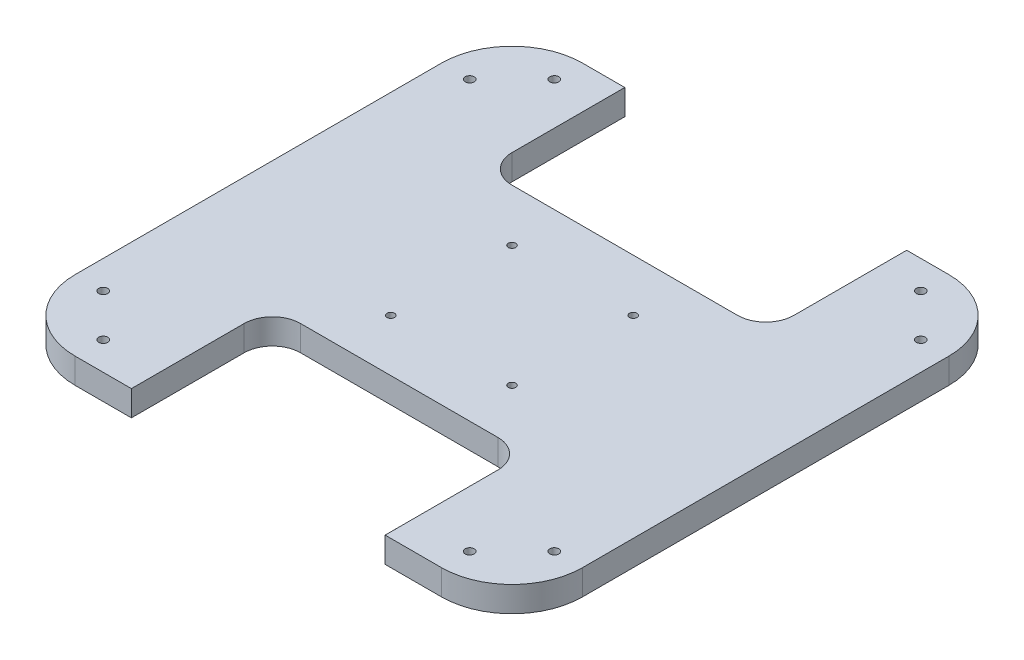
from build123d import *

# Parameters (mm, degrees)
PLATE_DEPTH        = 9
SKETCH3_R          = 1.6
HEX_HOLES_DEPTH    = 128.597021909
SKETCH4_R          = 1.325
LIDAR_HOLES_DEPTH  = 128.597021909
SKETCH5_W          = 100
SKETCH5_H          = 50
SKETCH5_W_2        = 90
CUT_EXTRUDE1_DEPTH = 128.597021909
SKETCH6_R          = 3.5
CUT_EXTRUDE2_DEPTH = 5
FILLET1_R          = 10


with BuildPart() as part:
    # Sketch1 → Plate (new body)
    with BuildSketch(Plane(origin=(0, 0, 0), x_dir=(1, 0, 0), z_dir=(0, 1, 0))):
        with BuildLine():
            Line((-65, -90), (65, -90))
            ThreePointArc((65, -90), (82.67766953, -82.67766953), (90, -65))
            Line((90, -65), (90, 65))
            ThreePointArc((90, 65), (82.67766953, 82.67766953), (65, 90))
            Line((65, 90), (-65, 90))
            ThreePointArc((-65, 90), (-82.67766953, 82.67766953), (-90, 65))
            Line((-90, 65), (-90, -65))
            ThreePointArc((-90, -65), (-82.67766953, -82.67766953), (-65, -90))
        make_face()
    extrude(amount=PLATE_DEPTH)

    # Sketch3 → Hex Holes (cut, through all)
    with BuildSketch(Plane(origin=(0, 9, 0), x_dir=(1, 0, 0), z_dir=(0, 1, 0))):
        with Locations((-65, 80)):
            Circle(SKETCH3_R)
        with Locations((-80, 65)):
            Circle(SKETCH3_R)
        with Locations((80, 65)):
            Circle(SKETCH3_R)
        with Locations((80, -65)):
            Circle(SKETCH3_R)
        with Locations((65, 80)):
            Circle(SKETCH3_R)
        with Locations((65, -80)):
            Circle(SKETCH3_R)
        with Locations((-65, -80)):
            Circle(SKETCH3_R)
        with Locations((-80, -65)):
            Circle(SKETCH3_R)
    extrude(amount=-HEX_HOLES_DEPTH, mode=Mode.SUBTRACT)

    # Sketch4 → LiDAR Holes (cut, through all)
    with BuildSketch(Plane(origin=(0, 9, 0), x_dir=(1, 0, 0), z_dir=(0, 1, 0))):
        with Locations((-21.5, 21.5)):
            Circle(SKETCH4_R)
        with Locations((21.5, 21.5)):
            Circle(SKETCH4_R)
        with Locations((21.5, -21.5)):
            Circle(SKETCH4_R)
        with Locations((-21.5, -21.5)):
            Circle(SKETCH4_R)
    extrude(amount=-LIDAR_HOLES_DEPTH, mode=Mode.SUBTRACT)

    # Sketch5 → Cut-Extrude1 (cut, through all)
    with BuildSketch(Plane(origin=(0, 9, 0), x_dir=(1, 0, 0), z_dir=(0, 1, 0))):
        with Locations((0, 65)):
            Rectangle(SKETCH5_W, SKETCH5_H)
        with Locations((0, -65)):
            Rectangle(SKETCH5_W_2, SKETCH5_H)
    extrude(amount=-CUT_EXTRUDE1_DEPTH, mode=Mode.SUBTRACT)

    # Sketch6 → Cut-Extrude2 (cut)
    with BuildSketch(Plane.XZ):
        with Locations((-21.5, 21.5)):
            Circle(SKETCH6_R)
        with Locations((21.5, 21.5)):
            Circle(SKETCH6_R)
        with Locations((-21.5, -21.5)):
            Circle(SKETCH6_R)
        with Locations((21.5, -21.5)):
            Circle(SKETCH6_R)
    extrude(amount=-CUT_EXTRUDE2_DEPTH, mode=Mode.SUBTRACT)

    # Fillet1
    fillet1_edges = [part.edges().sort_by_distance(p)[0] for p in [
        (45, 4.5, 40),
        (-45, 4.5, 40),
        (50, 4.5, -40),
        (-50, 4.5, -40),
    ]]
    fillet(fillet1_edges, radius=FILLET1_R)


solid = part.part
